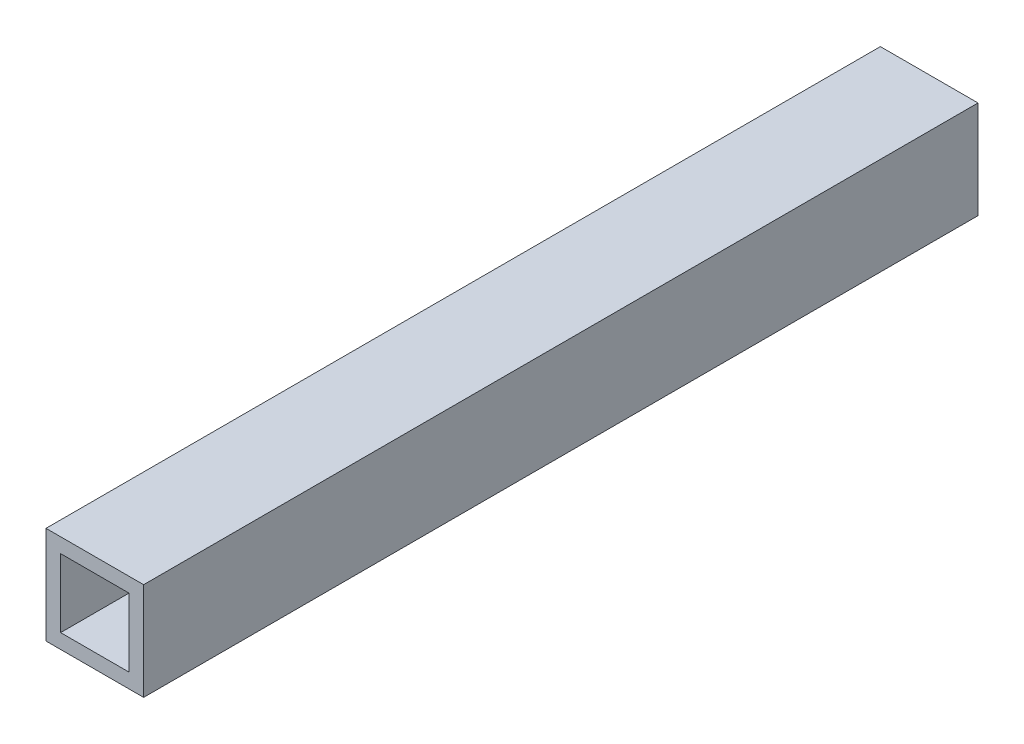
from build123d import *

# Parameters (mm, degrees)
ESQUISSE1_W        = 11.7
ESQUISSE1_H        = 11.7
ESQUISSE1_W_2      = 8.2
ESQUISSE1_H_2      = 8.2
BOSS_EXTRU_1_DEPTH = 100


with BuildPart() as part:
    # Esquisse1 → Boss.-Extru.1 (new body)
    with BuildSketch(Plane.XY):
        with Locations((5.85, 5.85)):
            Rectangle(ESQUISSE1_W, ESQUISSE1_H)
        with Locations((5.85, 5.85)):
            Rectangle(ESQUISSE1_W_2, ESQUISSE1_H_2, mode=Mode.SUBTRACT)
    extrude(amount=BOSS_EXTRU_1_DEPTH)


solid = part.part
